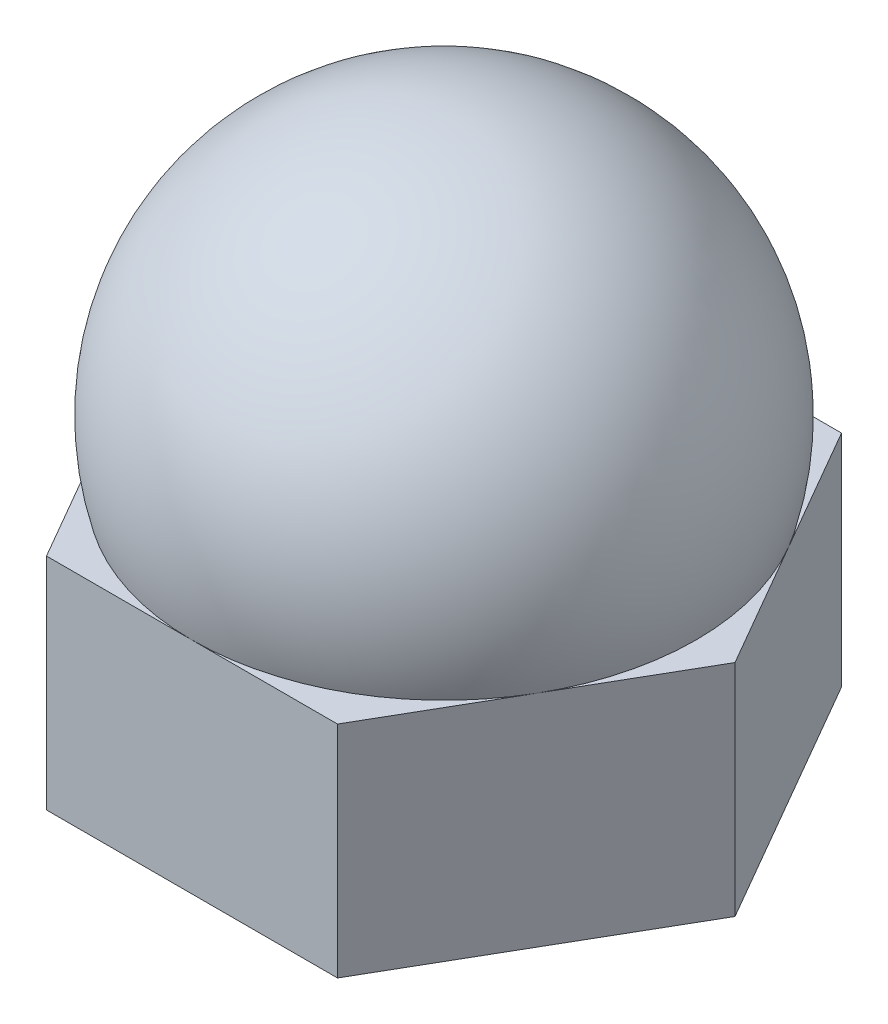
from build123d import *

# Parameters (mm, degrees)
CROQUIS1_R              = 1.25
SALIENTE_EXTRUIR1_DEPTH = 2.4


with BuildPart() as part:
    # Croquis1 → Saliente-Extruir1 (new body)
    with BuildSketch(Plane(origin=(0, 0, 0), x_dir=(1, 0, 0), z_dir=(0, 1, 0))):
        Polygon((-1.58771324, 2.75), (-3.175426481, 0), (-1.58771324, -2.75), (1.58771324, -2.75), (3.175426481, 0), (1.58771324, 2.75), align=None)
        Circle(CROQUIS1_R, mode=Mode.SUBTRACT)
    extrude(amount=SALIENTE_EXTRUIR1_DEPTH)

    # Croquis3 → Revolución2 (revolve)
    with BuildSketch(Plane(origin=(0, 0, 0), x_dir=(0, 0, -1), z_dir=(1, 0, 0))):
        with BuildLine():
            ThreePointArc((0, 6), (-2.265088298, 4.879928561), (-2.75, 2.4))
            Line((-2.75, 2.4), (0, 2.4))
            Line((0, 2.4), (0, 6))
        make_face()
    revolve(axis=Axis((0, 6, 0), (0, -1, 0)))


solid = part.part
